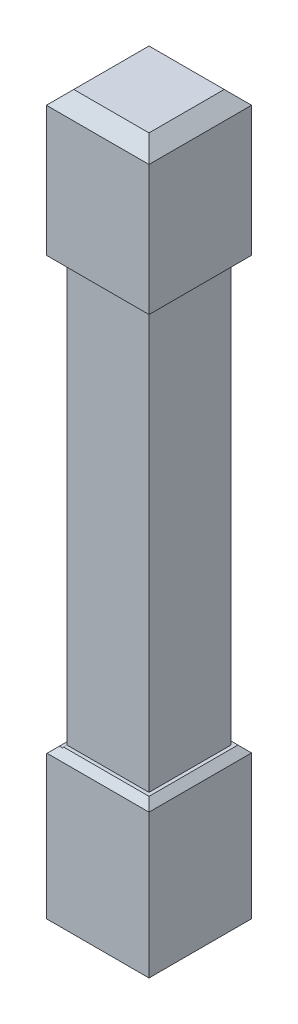
from build123d import *

# Parameters (mm, degrees)
ESQUISSE1_W             = 75
ESQUISSE1_H             = 1050
BOSS_EXTRU_2_DEPTH      = 150
ESQUISSE2_W             = 226.933426854
ESQUISSE2_H             = 610
ENL_V_MAT_EXTRU_1_DEPTH = 15
ESQUISSE3_W             = 179.782352086
ESQUISSE3_H             = 610.96446809
ENL_V_MAT_EXTRU_2_DEPTH = 15
ESQUISSE4_W             = 199.341724475
ESQUISSE4_H             = 610
ENL_V_MAT_EXTRU_3_DEPTH = 15
ESQUISSE5_W             = 150
ESQUISSE5_H             = 610
ENL_V_MAT_EXTRU_4_DEPTH = 15
CHANFREIN1_SIZE         = 20
CHANFREIN2_SIZE         = 10
CHANFREIN3_SIZE         = 10


with BuildPart() as part:
    # Esquisse1 → Boss.-Extru.2 (new body)
    with BuildSketch(Plane.XY):
        with Locations((-37.5, 160.509714461)):
            Rectangle(ESQUISSE1_W, ESQUISSE1_H)
    boss_extru_2 = extrude(amount=BOSS_EXTRU_2_DEPTH)

    # Symétrie1: Boss.-Extru.2 across plane
    add(boss_extru_2.mirror(Plane(origin=(0, 685.509714461, 150), x_dir=(0, 0, 1), z_dir=(-1, 0, 0))))

    # Esquisse2 → Enlèv. mat.-Extru.1 (cut)
    with BuildSketch(Plane.XY):
        with Locations((0, 160.509714461)):
            Rectangle(ESQUISSE2_W, ESQUISSE2_H)
    extrude(amount=ENL_V_MAT_EXTRU_1_DEPTH, mode=Mode.SUBTRACT)

    # Esquisse3 → Enlèv. mat.-Extru.2 (cut)
    with BuildSketch(Plane.ZY.offset(75)):
        with Locations((89.891176043, 160.027480416)):
            Rectangle(ESQUISSE3_W, ESQUISSE3_H)
    extrude(amount=-ENL_V_MAT_EXTRU_2_DEPTH, mode=Mode.SUBTRACT)

    # Esquisse4 → Enlèv. mat.-Extru.3 (cut)
    with BuildSketch(Plane(origin=(75, 0, 0), x_dir=(0, 0, -1), z_dir=(1, 0, 0))):
        with Locations((-99.670862238, 160.509714461)):
            Rectangle(ESQUISSE4_W, ESQUISSE4_H)
    extrude(amount=-ENL_V_MAT_EXTRU_3_DEPTH, mode=Mode.SUBTRACT)

    # Esquisse5 → Enlèv. mat.-Extru.4 (cut)
    with BuildSketch(Plane.XY.offset(150)):
        with Locations((0, 160.509714461)):
            Rectangle(ESQUISSE5_W, ESQUISSE5_H)
    extrude(amount=-ENL_V_MAT_EXTRU_4_DEPTH, mode=Mode.SUBTRACT)

    # Chanfrein1
    chanfrein1_edges = [part.edges().sort_by_distance(p)[0] for p in [
        (75, 685.509714461, 75),
        (0, 685.509714461, 0),
        (0, 685.509714461, 150),
        (-75, 685.509714461, 75),
    ]]
    chamfer(chanfrein1_edges, length=CHANFREIN1_SIZE)

    # Chanfrein2
    chanfrein2_edges = [part.edges().sort_by_distance(p)[0] for p in [
        (75, 465.509714461, 75),
        (0, 465.509714461, 0),
        (-75, 465.509714461, 75),
        (0, 465.509714461, 150),
    ]]
    chamfer(chanfrein2_edges, length=CHANFREIN2_SIZE)

    # Chanfrein3
    # the kernel refuses this chamfer: 10 mm, written as the material it takes off along each edge
    with BuildSketch(Plane(origin=(-75, -145.454753629, 175.71682988), x_dir=(0.9996219169112968, 0.0274958766105877, 0), z_dir=(0, 0, -1))) as chanfrein3_piece_1:
        Polygon((CHANFREIN3_SIZE * 0.999621916911, CHANFREIN3_SIZE * 0.0274958766106), (-CHANFREIN3_SIZE * 0.0274958766106, CHANFREIN3_SIZE * 0.999621916911), (0, 0), align=None)
    extrude(amount=201.433659759, mode=Mode.SUBTRACT)
    with BuildSketch(Plane(origin=(-85.71682988, -144.490285539, 150), x_dir=(0, 0.027495876610587663, -0.9996219169112968), z_dir=(1, 0, 0)), Plane(origin=(100.71682988, -144.490285539, 0), x_dir=(0, 0.0274958766105877, 0.9996219169112968), z_dir=(-1, 0, 0))) as chanfrein3_piece_2:
        Polygon((CHANFREIN3_SIZE * 0.999621916911, -CHANFREIN3_SIZE * 0.0274958766106), (-CHANFREIN3_SIZE * 0.0274958766106, -CHANFREIN3_SIZE * 0.999621916911), (0, 0), align=None)
    extrude(amount=186.433659759, mode=Mode.SUBTRACT)
    with BuildSketch(Plane(origin=(75, -144.490285539, 175.71682988), x_dir=(-0.9996219169112968, 0.0274958766105877, 0), z_dir=(0, 0, -1))) as chanfrein3_piece_3:
        Polygon((CHANFREIN3_SIZE * 0.999621916911, -CHANFREIN3_SIZE * 0.0274958766106), (-CHANFREIN3_SIZE * 0.0274958766106, -CHANFREIN3_SIZE * 0.999621916911), (0, 0), align=None)
    extrude(amount=201.433659759, mode=Mode.SUBTRACT)


solid = part.part
